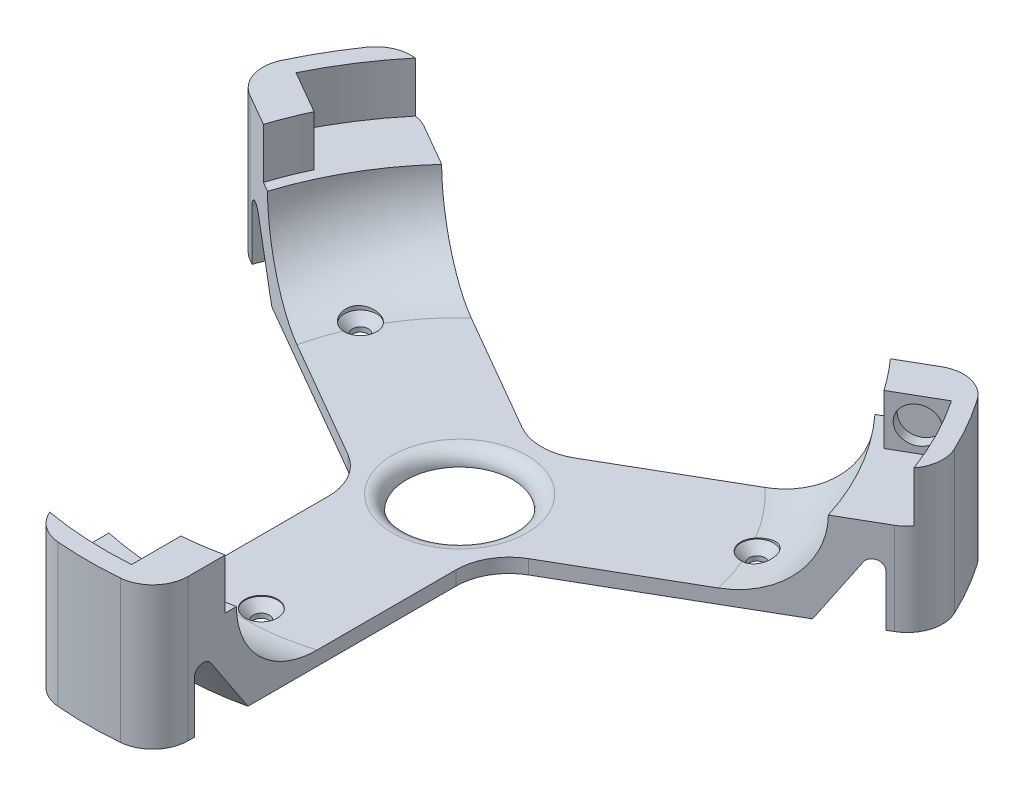
from build123d import *

# Parameters (mm, degrees)
SKETCH2_R                                      = 105
SKETCH2_R_2                                    = 83
BOSS_EXTRUDE1_DEPTH                            = 22
BOSS_EXTRUDE2_START                            = 4
SKETCH5_R                                      = 105
BOSS_EXTRUDE2_DEPTH                            = 4
CUT_EXTRUDE1_DEPTH                             = 151.751451088
CUT_EXTRUDE2_DEPTH                             = 20
CUT_EXTRUDE2_DEPTH_BACK                        = 0.25
SKETCH9_R                                      = 4.6
SKETCH15_R                                     = 15
CUT_EXTRUDE5_DEPTH                             = 12
FILLET1_R                                      = 15
FILLET2_R                                      = 10
FILLET4_R                                      = 4
CSK_FOR_M4_FLAT_HEAD_MACHINE_SCREW3_AT_2_COUNT = 2
CSK_FOR_M4_FLAT_HEAD_MACHINE_SCREW3_AT_2_PITCH = 100.955435713
CSK_FOR_M4_FLAT_HEAD_MACHINE_SCREW3_AT_3_COUNT = 2
CSK_FOR_M4_FLAT_HEAD_MACHINE_SCREW3_AT_3_PITCH = 100.955435713
BOSS_EXTRUDE4_DEPTH                            = 14.2
SKETCH18_R                                     = 5.1
CUT_EXTRUDE6_DEPTH                             = 3.1
CIRPATTERN1_COUNT                              = 3
FILLET5_R                                      = 2.5


with BuildPart() as part:
    # Sketch2 → Boss-Extrude1 (new body)
    with BuildSketch(Plane(origin=(0, 0, 0), x_dir=(1, 0, 0), z_dir=(0, 1, 0))):
        with Locations(Location((0, 0, 0), (0, 0, 270))):
            Circle(SKETCH2_R)
        with Locations(Location((0, 0, 0), (0, 0, 270))):
            Circle(SKETCH2_R_2, mode=Mode.SUBTRACT)
    extrude(amount=BOSS_EXTRUDE1_DEPTH)

    # Sketch4 → Revolve5 (revolve)
    with BuildSketch(Plane.XY):
        with BuildLine():
            Line((83, 22), (83, 0))
            Line((83, 0), (61, 0))
            add(Edge.make_bspline(
                [(61, 0), (83, 0), (83, 22)],
                knots=[3.141592654, 3.141592654, 3.141592654, 4.71238898, 4.71238898, 4.71238898], degree=2, weights=[1, 0.707106781, 1]))
        make_face()
    revolve(axis=Axis((0, 22, 0), (0, -1, 0)))

    # Sketch5 → Boss-Extrude2 (add)
    with BuildSketch(Plane.XZ.offset(BOSS_EXTRUDE2_START)):
        with Locations(Location((0, 0, 0), (0, 0, 270))):
            Circle(SKETCH5_R)
    extrude(amount=-BOSS_EXTRUDE2_DEPTH)

    # Sketch6 → Cut-Extrude1 (cut, through all)
    with BuildSketch(Plane.XZ.offset(4)):
        with BuildLine():
            Line((18, 10.392304845), (18, 58.283788484))
            Line((18, 58.283788484), (18, 148.916083752))
            ThreePointArc((18, 148.916083752), (129.903810568, 75), (137.965111561, -58.869584608))
            Line((137.965111561, -58.869584608), (59.475241456, -13.553436974))
            Line((59.475241456, -13.553436974), (18, 10.392304845))
        make_face()
        with BuildLine():
            Line((-18, 10.392304845), (-18, 58.283788484))
            Line((-18, 58.283788484), (-18, 148.916083752))
            ThreePointArc((-18, 148.916083752), (-129.903810568, 75), (-137.965111561, -58.869584608))
            Line((-137.965111561, -58.869584608), (-59.475241456, -13.553436974))
            Line((-59.475241456, -13.553436974), (-18, 10.392304845))
        make_face()
        with BuildLine():
            Line((0, -20.784609691), (41.475241456, -44.73035151))
            Line((41.475241456, -44.73035151), (119.965111561, -90.046499144))
            ThreePointArc((119.965111561, -90.046499144), (0, -150), (-119.965111561, -90.046499144))
            Line((-119.965111561, -90.046499144), (-41.475241456, -44.73035151))
            Line((-41.475241456, -44.73035151), (0, -20.784609691))
        make_face()
    extrude(amount=-CUT_EXTRUDE1_DEPTH, mode=Mode.SUBTRACT)

    # Sketch9 → Cut-Extrude2 (cut, two sides: drawn at the far end of the back side and taken through both)
    with BuildSketch(Plane(origin=(0, 0, 0), x_dir=(1, 0, 0), z_dir=(0, 1, 0)).offset(-CUT_EXTRUDE2_DEPTH_BACK)):
        with Locations(Location((0, -56, 0), (0, 0, 270))):
            Circle(SKETCH9_R)
        with Locations(Location((-56, 28, 0), (0, 0, 270))):
            Circle(SKETCH9_R)
        with Locations(Location((56, 28, 0), (0, 0, 270))):
            Circle(SKETCH9_R)
    extrude(amount=CUT_EXTRUDE2_DEPTH + CUT_EXTRUDE2_DEPTH_BACK, mode=Mode.SUBTRACT)

    # Sketch15 → Cut-Extrude5 (cut)
    with BuildSketch(Plane(origin=(0, 0, 0), x_dir=(1, 0, 0), z_dir=(0, 1, 0))):
        with Locations(Location((0, 0, 0), (0, 0, 270))):
            Circle(SKETCH15_R)
    extrude(amount=-CUT_EXTRUDE5_DEPTH, mode=Mode.SUBTRACT)

    # Fillet1
    fillet1_edges = [part.edges().sort_by_distance(p)[0] for p in [
        (-18, -2, 10.392304845),
        (18, -2, 10.392304845),
        (0, -2, -20.784609691),
    ]]
    fillet(fillet1_edges, radius=FILLET1_R)

    # Fillet2
    fillet2_edges = [part.edges().sort_by_distance(p)[0] for p in [
        (-18, 9, 103.445637897),
        (-98.58655033, 9, -36.134361681),
        (98.58655033, 9, -36.134361681),
        (18, 9, 103.445637897),
        (-80.58655033, 9, -67.311276217),
        (80.58655033, 9, -67.311276217),
    ]]
    fillet(fillet2_edges, radius=FILLET2_R)

    # Fillet4
    fillet4_edges = [part.edges().sort_by_distance(p)[0] for p in [
        (0, 0, -15),
    ]]
    fillet(fillet4_edges, radius=FILLET4_R - 0.0001)  # a hair under: the kernel refuses the full size

    # Sketch14 → CSK for M4 Flat Head Machine Screw3 (revolve, cut)
    with BuildSketch(Plane(origin=(0, -0.25, 56), x_dir=(0, 0, 1), z_dir=(1, 0, 0))):
        Polygon((0, 0), (0, 3.75), (2.25, 3.75), (2.25, 2.45), (4.7, 0), align=None)
    csk_for_m4_flat_head_machine_screw3 = revolve(axis=Axis((0, 6.1, 56), (0, -1, 0)), mode=Mode.SUBTRACT)

    # CSK for M4 Flat Head Machine Screw3 at 2: CSK for M4 Flat Head Machine Screw3 ×2
    with Locations(*[Vector(-0.5547001962252337, 0, -0.8320502943378407) * (i * CSK_FOR_M4_FLAT_HEAD_MACHINE_SCREW3_AT_2_PITCH) for i in range(1, CSK_FOR_M4_FLAT_HEAD_MACHINE_SCREW3_AT_2_COUNT)]):
        add(csk_for_m4_flat_head_machine_screw3, mode=Mode.SUBTRACT)

    # CSK for M4 Flat Head Machine Screw3 at 3: CSK for M4 Flat Head Machine Screw3 ×2
    with Locations(*[Vector(0.554700196225225, 0, -0.8320502943378464) * (i * CSK_FOR_M4_FLAT_HEAD_MACHINE_SCREW3_AT_3_PITCH) for i in range(1, CSK_FOR_M4_FLAT_HEAD_MACHINE_SCREW3_AT_3_COUNT)]):
        add(csk_for_m4_flat_head_machine_screw3, mode=Mode.SUBTRACT)

    # Sketch16 → Boss-Extrude4 (add)
    with BuildSketch(Plane(origin=(0, 22, 0), x_dir=(1, 0, 0), z_dir=(0, 1, 0))):
        with BuildLine():
            Line((-89.93398289, 43.725035409), (-77.860833665, 36.754599453))
            ThreePointArc((-77.860833665, 36.754599453), (-80.053018806, 31.697384436), (-81.917127618, 26.51026599))
            Line((-81.917127618, 26.51026599), (-90.980180532, 31.74282203))
            ThreePointArc((-90.980180532, 31.74282203), (-95.521784185, 37.410117712), (-95.030725851, 44.656031443))
            ThreePointArc((-95.030725851, 44.656031443), (-90.932667397, 52.5), (-86.188620588, 59.971007005))
            ThreePointArc((-86.188620588, 59.971007005), (-82.02839026, 63.403442174), (-76.69057104, 64.175979257))
            ThreePointArc((-76.69057104, 64.175979257), (-83.937451529, 54.355351446), (-89.93398289, 43.725035409))
        make_face()
    boss_extrude4 = extrude(amount=BOSS_EXTRUDE4_DEPTH)

    # Sketch18 → Cut-Extrude6 (cut)
    with BuildSketch(Plane(origin=(-3.55, 0, 6.148780367), x_dir=(-0.8660254037844364, 0, -0.5000000000000041), z_dir=(0.5000000000000041, 0, -0.8660254037844364))):
        with Locations((92.80675964, 29)):
            Circle(SKETCH18_R)
    cut_extrude6 = extrude(amount=-CUT_EXTRUDE6_DEPTH, mode=Mode.SUBTRACT)

    # CirPattern1: Boss-Extrude4, Cut-Extrude6 ×3 about axis
    cirpattern1_axis = Axis((0, 0, 0), (0, 1, 0))
    add([boss_extrude4.rotate(cirpattern1_axis, i * 360 / CIRPATTERN1_COUNT) for i in range(1, CIRPATTERN1_COUNT)])
    add([cut_extrude6.rotate(cirpattern1_axis, i * 360 / CIRPATTERN1_COUNT) for i in range(1, CIRPATTERN1_COUNT)], mode=Mode.SUBTRACT)

    # Sketch19 → Cut-Revolve1 (revolve, cut)
    with BuildSketch(Plane.ZY, mode=Mode.PRIVATE) as cut_revolve1_sk:
        Polygon((94.662558596, -4), (79.82631139, -4), (94.662558596, 18.939923911), align=None)
    revolve(cut_revolve1_sk.sketch.rotate(Axis((0, 22, 0), (0, -1, 0)), 180), axis=Axis((0, 22, 0), (0, -1, 0)), mode=Mode.SUBTRACT)

    # Fillet5
    fillet5_edges = [part.edges().sort_by_distance(p)[0] for p in [
        (-81.980180532, 18.939923911, -47.331279298),
        (81.980180532, 18.939923911, -47.331279298),
        (0, 18.939923911, 94.662558596),
    ]]
    fillet(fillet5_edges, radius=FILLET5_R)


solid = part.part
